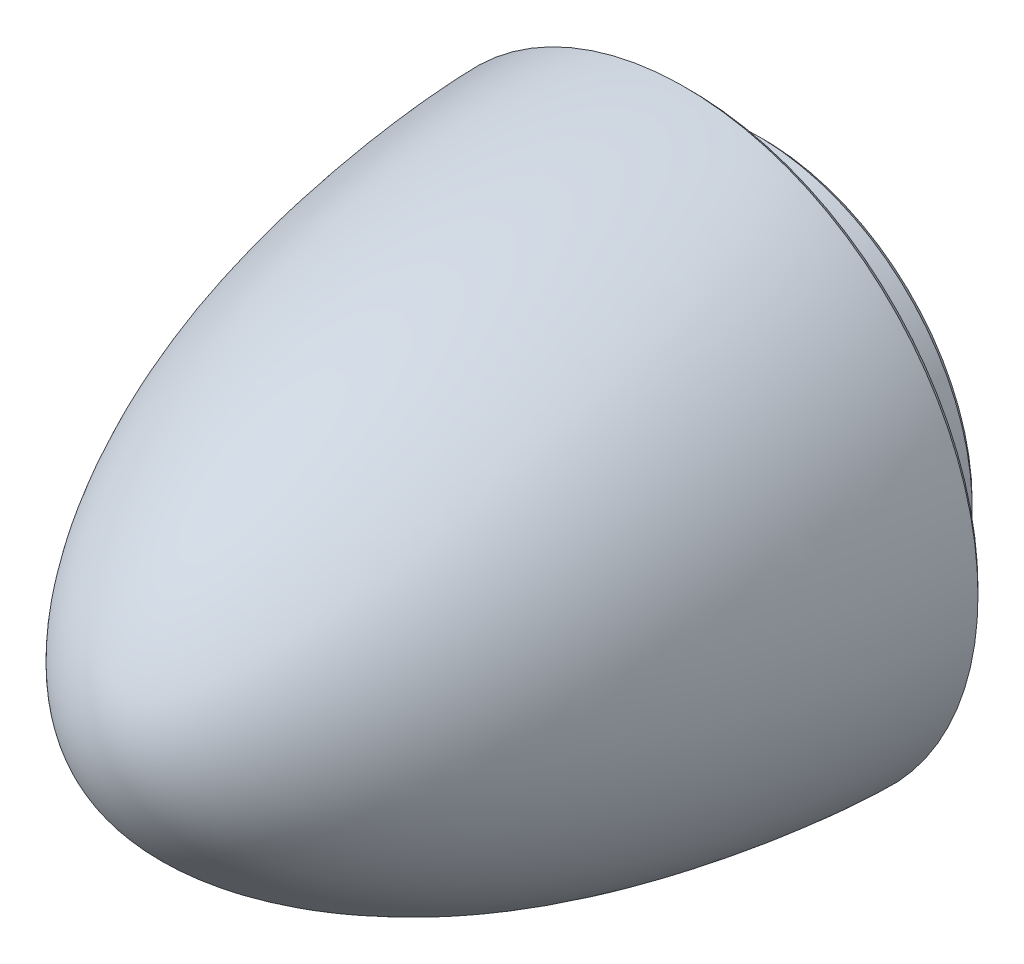
from build123d import *

# Parameters (mm, degrees)
SKETCH3_R           = 9.271
BOSS_EXTRUDE1_DEPTH = 3.175
FILLET1_R           = 0.254


with BuildPart() as part:
    # Sketch2 → Revolve5 (revolve)
    with BuildSketch(Plane(origin=(0, 0, 0.100515376), x_dir=(1, 0, 0), z_dir=(0, 1, 0))):
        with BuildLine():
            Line((0, 0), (0, 25.4))
            Line((0, 25.4), (12.7, 25.4))
            add(Edge.make_bspline(
                [(0, 0), (4.251787512, -0.000213004), (11.607750415, 10.081742809), (12.7, 23.292671224), (12.7, 25.4)],
                knots=[0.5, 0.5, 0.5, 0.5, 0.789002784, 1, 1, 1, 1], degree=3))
        make_face()
    revolve(axis=Axis((0, 0, 0.100515376), (0, 0, -1)))

    # Sketch3 → Boss-Extrude1 (add)
    with BuildSketch(Plane(origin=(0, 0, -25.299484624), x_dir=(-1, 0, 0), z_dir=(0, 0, -1))):
        Circle(SKETCH3_R)
    extrude(amount=BOSS_EXTRUDE1_DEPTH)

    # Fillet1
    fillet1_edges = [part.edges().sort_by_distance(p)[0] for p in [
        (9.271, 0, -25.299484624),
    ]]
    fillet(fillet1_edges, radius=FILLET1_R)

    # Chamfer1: read off the stored shape, not the designer's step
    # Chamfer1 outline → Chamfer1 (revolve, cut)
    with BuildSketch(Plane.XZ):
        Polygon((9.271, -28.220484624), (9.017, -28.474484624), (9.271, -28.474484624), align=None)
        Polygon((12.698013115, -25.047471509), (12.446, -25.299484624), (12.698013115, -25.299484624), align=None)
    revolve(axis=Axis((0, 0, 0), (0, 0, 1)), mode=Mode.SUBTRACT)

    # Chamfer1 2 outline → Chamfer1 2 (revolve, cut)
    with BuildSketch(Plane.XZ):
        with BuildLine():
            add(Edge.make_bspline(
                [(12.698013115, -25.047471509), (12.699349278, -25.136229047), (12.7, -25.220304585), (12.7, -25.299484624)],
                knots=[0.992072064, 0.992072064, 0.992072064, 0.992072064, 1, 1, 1, 1], degree=3))
            Line((12.698013115, -25.047471509), (12.698013115, -25.299484624))
            Line((12.698013115, -25.299484624), (12.7, -25.299484624))
        make_face()
    revolve(axis=Axis((0, 0, 0), (0, 0, 1)), mode=Mode.SUBTRACT)


solid = part.part
